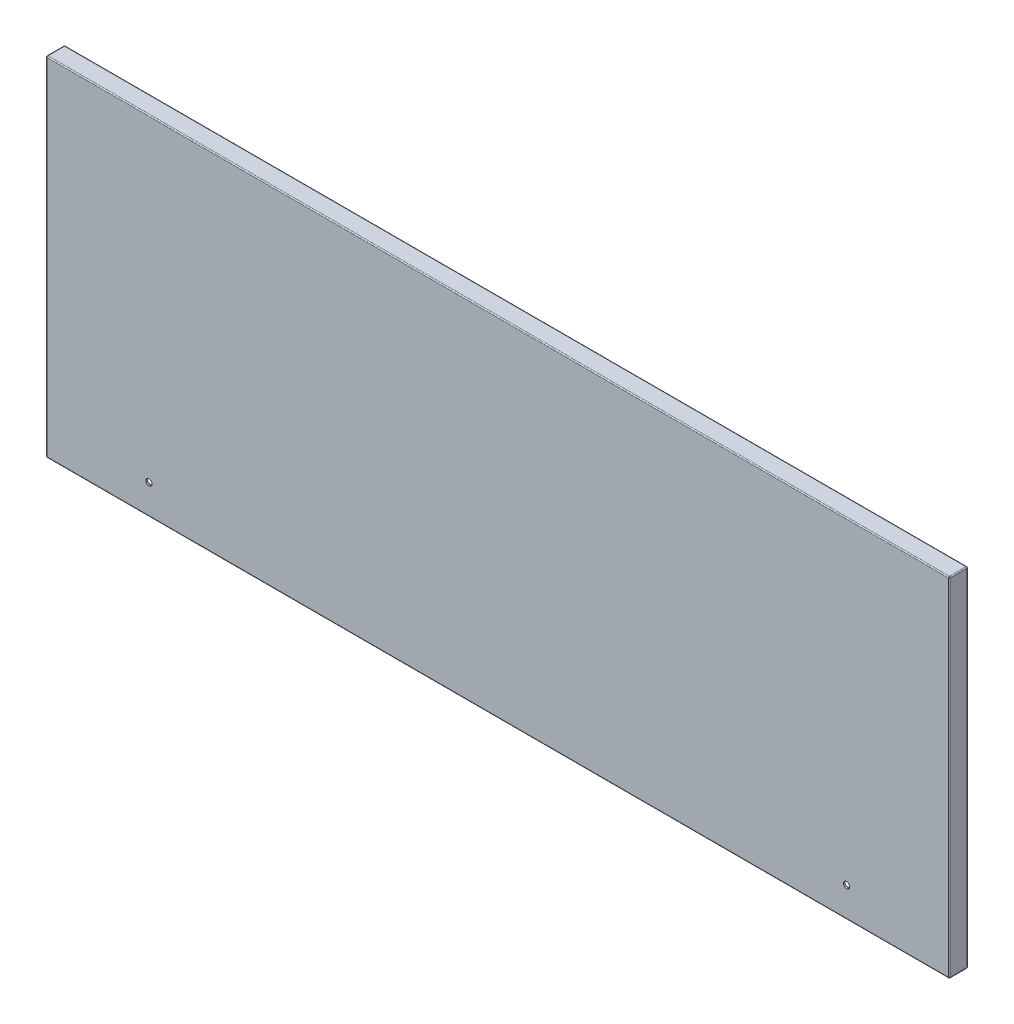
from build123d import *

# Parameters (mm, degrees)
SKETCH_1_W          = 878
SKETCH_1_H          = 338
EXTRUDE_1_DEPTH     = 1.5
SKETCH_2_W          = 878
SKETCH_2_H          = 338
SKETCH_2_W_2        = 875
SKETCH_2_H_2        = 335
EXTRUDE_2_DEPTH     = 15
SKETCH_3_W          = 878
SKETCH_3_H          = 338
SKETCH_3_W_2        = 848
SKETCH_3_H_2        = 318
EXTRUDE_3_DEPTH     = 1.5
SKETCH_6_R          = 3
CUT_EXTRUDE_1_DEPTH = 471.750464684
FILLET_1_R          = 1
EXTRUDE_5_REACH     = 550.249
FILLET_START        = -159
FILLET_2_DEPTH      = 318
FILLET_START_2      = 133.01507
FILLET_2_2_DEPTH    = 34.48493


with BuildPart() as part:
    # 草图1 → 凸台-拉伸1 (new body)
    with BuildSketch(Plane.XY):
        Rectangle(SKETCH_1_W, SKETCH_1_H)
    extrude(amount=EXTRUDE_1_DEPTH)

    # 草图2 → 凸台-拉伸2 (add)
    with BuildSketch(Plane(origin=(0, 0, 0), x_dir=(-1, 0, 0), z_dir=(0, 0, -1))):
        Rectangle(SKETCH_2_W, SKETCH_2_H)
        Rectangle(SKETCH_2_W_2, SKETCH_2_H_2, mode=Mode.SUBTRACT)
    extrude(amount=EXTRUDE_2_DEPTH)

    # 草图3 → 凸台-拉伸3 (add)
    with BuildSketch(Plane(origin=(0, 0, -15), x_dir=(-1, 0, 0), z_dir=(0, 0, -1))):
        Rectangle(SKETCH_3_W, SKETCH_3_H)
        Rectangle(SKETCH_3_W_2, SKETCH_3_H_2, mode=Mode.SUBTRACT)
    extrude(amount=EXTRUDE_3_DEPTH)

    # 草图6 → 切除-拉伸1 (cut, through all)
    with BuildSketch(Plane.XY.offset(1.5)):
        with Locations((-339, -140)):
            Circle(SKETCH_6_R)
        with Locations((339, -140)):
            Circle(SKETCH_6_R)
    extrude(amount=-CUT_EXTRUDE_1_DEPTH, mode=Mode.SUBTRACT)

    # 圆角1
    fillet_1_edges = [part.edges().sort_by_distance(p)[0] for p in [
        (439, 0, 1.5),
        (0, 169, 1.5),
        (-439, 0, -16.5),
        (0, 169, -16.5),
        (439, 0, -16.5),
        (0, -169, -16.5),
        (-439, 0, 1.5),
        (0, -169, 1.5),
        (-439, 169, -7.5),
        (439, 169, -7.5),
        (439, -169, -7.5),
        (-439, -169, -7.5),
    ]]
    fillet(fillet_1_edges, radius=FILLET_1_R)

    # 草图9 → 凸台-拉伸5 (add, up to next)
    with BuildSketch(Plane(origin=(0, -159, 0), x_dir=(1, 0, 0), z_dir=(0, 1, 0)), mode=Mode.PRIVATE) as extrude_5_sk1:
        Polygon((15, 0), (15, 16.5), (-15, 16.5), (-15, 0), (-13.5, 0), (-13.5, 15), (13.5, 15), (13.5, 0), align=None)
    extrude_5_tool1 = extrude(extrude_5_sk1.sketch, amount=EXTRUDE_5_REACH, mode=Mode.PRIVATE) - part.part
    add(extrude_5_tool1.solids().sort_by_distance((14.657619, -159, -8.25))[0])

    # 圆角2: read off the stored shape, not the designer's step
    # 圆角2 outline → 圆角2 (cut)
    with BuildSketch(Plane(origin=(0, 0, 0), x_dir=(1, 0, 0), z_dir=(0, 1, 0)).offset(FILLET_START)):
        with BuildLine():
            ThreePointArc((-15, 14.5), (-14.414213562, 15.914213562), (-13, 16.5))
            Line((-13, 16.5), (-15, 16.5))
            Line((-15, 16.5), (-15, 14.5))
        make_face()
        with BuildLine():
            Line((15, 14.5), (15, 16.5))
            Line((15, 16.5), (13, 16.5))
            ThreePointArc((13, 16.5), (14.414213562, 15.914213562), (15, 14.5))
        make_face()
    extrude(amount=FILLET_2_DEPTH, mode=Mode.SUBTRACT)

    # Fillet 2 2 outline → Fillet 2 2 (cut)
    with BuildSketch(Plane(origin=(0, 0, 0), x_dir=(1, 0, 0), z_dir=(0, 1, 0)).offset(FILLET_START_2)):
        with BuildLine():
            Line((-15, 15), (-15, 14.5))
            ThreePointArc((-15, 14.5), (-14.984059392, 14.752008585), (-14.936491673, 15))
            Line((-14.936491673, 15), (-15, 15))
        make_face()
        with BuildLine():
            Line((15, 15), (14.936491673, 15))
            ThreePointArc((14.936491673, 15), (14.984059392, 14.752008585), (15, 14.5))
            Line((15, 14.5), (15, 15))
        make_face()
    extrude(amount=FILLET_2_2_DEPTH, mode=Mode.SUBTRACT)


solid = part.part
